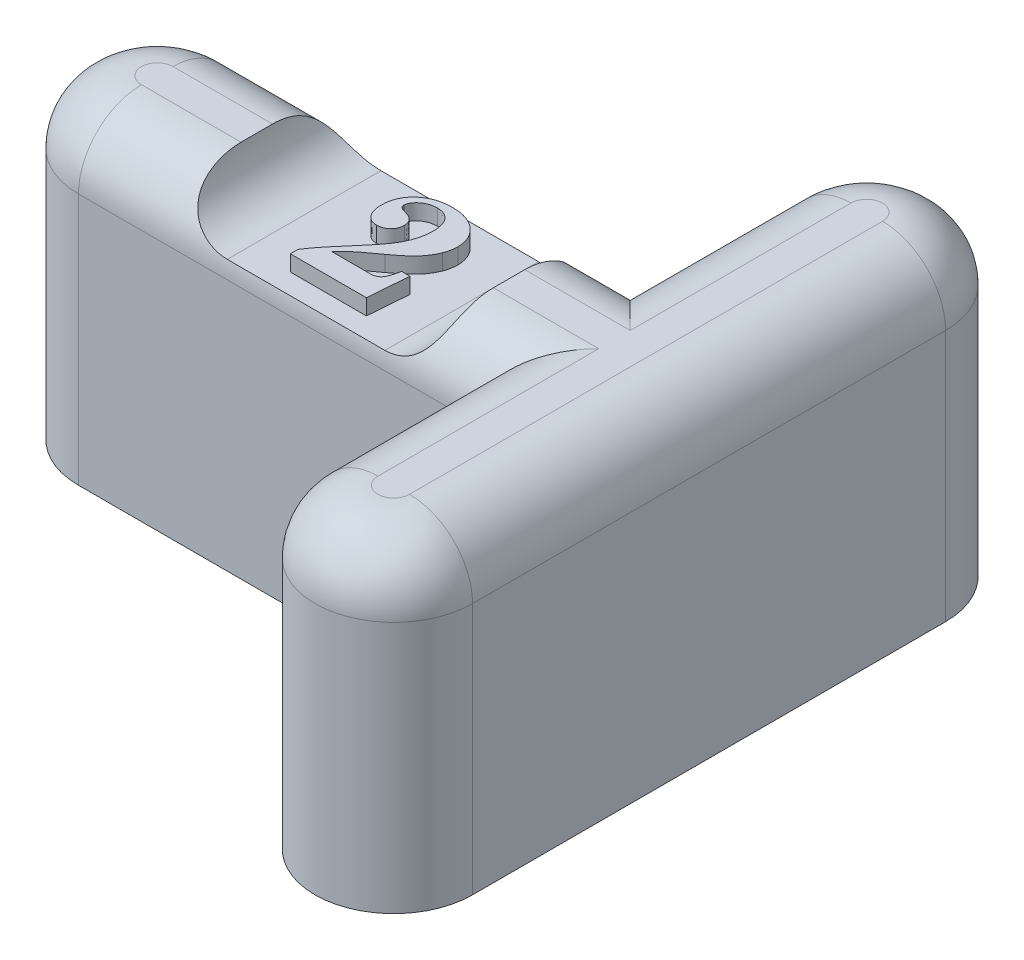
from build123d import *

# Parameters (mm, degrees)
BOSS_EXTRUDE1_DEPTH     = 20
FILLET1_R               = 4
SKETCH2_R               = 2.75
CUT_EXTRUDE1_DEPTH      = 1.5
LPATTERN1_COUNT         = 2
LPATTERN1_PITCH         = 30
CUT_EXTRUDE2_DEPTH      = 35.641016151
CUT_EXTRUDE2_DEPTH_BACK = 35.641016151
WRAP1_DEPTH             = 1


# Read off the part's stored shape, not the designer's step: Wrap1
with BuildPart() as part:
    # Sketch1 → Boss-Extrude1 (new body)
    with BuildSketch(Plane(origin=(0, 0, 0), x_dir=(1, 0, 0), z_dir=(0, 1, 0))):
        with BuildLine():
            Line((-15, -5), (10, -5))
            Line((10, -5), (10, -15))
            ThreePointArc((10, -15), (15, -20), (20, -15))
            Line((20, -15), (20, 15))
            ThreePointArc((20, 15), (15, 20), (10, 15))
            Line((10, 15), (10, 5))
            Line((10, 5), (-15, 5))
            ThreePointArc((-15, 5), (-20, 0), (-15, -5))
        make_face()
    extrude(amount=BOSS_EXTRUDE1_DEPTH)

    # Fillet1
    fillet1_edges = [part.edges().sort_by_distance(p)[0] for p in [
        (15, 20, 20),
        (20, 20, 0),
        (15, 20, -20),
        (10, 20, -10),
        (-2.5, 20, -5),
        (-20, 20, 0),
        (-2.5, 20, 5),
        (10, 20, 10),
    ]]
    fillet(fillet1_edges, radius=FILLET1_R)

    # Sketch2 → Cut-Extrude1 (cut)
    with BuildSketch(Plane.XZ):
        with Locations(Location((-15, 0, 0), (0, 0, 270))):
            Circle(SKETCH2_R)
    cut_extrude1 = extrude(amount=-CUT_EXTRUDE1_DEPTH, mode=Mode.SUBTRACT)

    # LPattern1: Cut-Extrude1 ×2
    with Locations(*[(i * LPATTERN1_PITCH, 0, 0) for i in range(1, LPATTERN1_COUNT)]):
        add(cut_extrude1, mode=Mode.SUBTRACT)

    # Sketch3 → Cut-Extrude2 (cut, two sides: drawn at the far end of the back side and taken through both)
    with BuildSketch(Plane.XY.offset(-CUT_EXTRUDE2_DEPTH_BACK)):
        with BuildLine():
            Line((4.311759309, 17), (-5.688240691, 17))
            ThreePointArc((-5.688240691, 17), (-8.688240691, 20), (-5.688240691, 23))
            Line((-5.688240691, 23), (4.311759309, 23))
            ThreePointArc((4.311759309, 23), (7.311759309, 20), (4.311759309, 17))
        make_face()
    extrude(amount=CUT_EXTRUDE2_DEPTH + CUT_EXTRUDE2_DEPTH_BACK, mode=Mode.SUBTRACT)

    # Wrap1 outline → Wrap1 (add)
    with BuildSketch(Plane(origin=(0, 17, 0), x_dir=(1, 0, 0), z_dir=(0, 1, 0))):
        with BuildLine():
            add(Edge.make_bspline(
                [(0.642286392, -2.130929983), (0.697068251, -2.128907224), (0.801863654, -2.125037772), (0.949149402, -2.083592189), (1.077845848, -2.017679587), (1.167841133, -1.937322521), (1.228987071, -1.856304156), (1.273909876, -1.779905728), (1.316783825, -1.687993871), (1.357834668, -1.580688743), (1.397843446, -1.45819824), (1.43651507, -1.32040959), (1.470556147, -1.166470279), (1.492845203, -1.058839499), (1.504465879, -1.002724855)],
                knots=[0, 0, 0, 0, 0.10403341, 0.199011557, 0.288612319, 0.377191825, 0.425797175, 0.481425289, 0.545557079, 0.61863331, 0.699984683, 0.790771883, 0.890916323, 1, 1, 1, 1], degree=3))
            Line((0.642286392, -2.130929983), (-1.828867454, -2.130929983))
            add(Edge.make_bspline(
                [(0.033312033, -0.597276137), (-0.0386828, -0.649792202), (-0.177152219, -0.750797632), (-0.378312337, -0.893483351), (-0.55842377, -1.029096706), (-0.723257087, -1.150840306), (-0.869351346, -1.262329216), (-0.998302375, -1.361959094), (-1.10903642, -1.449941477), (-1.28814467, -1.598324583), (-1.533492369, -1.817053984), (-1.730967833, -2.026898387), (-1.828867454, -2.130929983)],
                knots=[0, 0, 0, 0, 0.110593572, 0.212707314, 0.306051588, 0.390379305, 0.467018215, 0.534117187, 0.592614819, 0.642525788, 0.822780058, 1, 1, 1, 1], degree=3))
            add(Edge.make_bspline(
                [(1.776901777, 1.311377709), (1.740508951, 1.227820861), (1.668557348, 1.062622117), (1.534204098, 0.829135836), (1.386697948, 0.607494657), (1.244802071, 0.434383848), (1.118782123, 0.297042886), (1.007796173, 0.188820856), (0.882685975, 0.07346838), (0.742894284, -0.048629756), (0.587320619, -0.176805638), (0.415288522, -0.310610766), (0.2304995, -0.453672521), (0.100336358, -0.548465046), (0.033312033, -0.597276137)],
                knots=[0, 0, 0, 0, 0.10413489, 0.205883221, 0.307528832, 0.408265615, 0.461433854, 0.520606469, 0.585444086, 0.656004792, 0.732803839, 0.815893726, 0.905198979, 1, 1, 1, 1], degree=3))
            add(Edge.make_bspline(
                [(1.932350495, 2.136698222), (1.930582762, 2.062880935), (1.927122795, 1.918399078), (1.89755374, 1.706264085), (1.84849522, 1.503780463), (1.800603462, 1.375074458), (1.776901777, 1.311377709)],
                knots=[0, 0, 0, 0, 0.261979501, 0.512769921, 0.758869279, 1, 1, 1, 1], degree=3))
            add(Edge.make_bspline(
                [(-0.388162326, 4.125480273), (-0.303707583, 4.12339455), (-0.138146382, 4.119305794), (0.104348239, 4.094322221), (0.334199152, 4.049032745), (0.552032966, 3.987362832), (0.755746261, 3.904474972), (0.948486885, 3.807269943), (1.127008185, 3.688779019), (1.29265723, 3.555020212), (1.442651526, 3.408718608), (1.573777626, 3.252009266), (1.685027299, 3.086825419), (1.774984999, 2.912292074), (1.84656933, 2.730494708), (1.895481593, 2.539900922), (1.927600541, 2.341314519), (1.930747814, 2.205737762), (1.932350495, 2.136698222)],
                knots=[0, 0, 0, 0, 0.074102612, 0.14526736, 0.21355926, 0.279416432, 0.343556942, 0.406228654, 0.468492489, 0.531146675, 0.592790073, 0.652016559, 0.710119813, 0.767135501, 0.823967905, 0.881147087, 0.939476717, 1, 1, 1, 1], degree=3))
            add(Edge.make_bspline(
                [(-2.232713608, 3.426762325), (-2.174578401, 3.482587233), (-2.058827061, 3.593738602), (-1.864882005, 3.736329065), (-1.656738454, 3.857947931), (-1.432063466, 3.955468271), (-1.192752558, 4.032638511), (-0.937718651, 4.086841711), (-0.667834214, 4.118962783), (-0.482802481, 4.123274773), (-0.388162326, 4.125480273)],
                knots=[0, 0, 0, 0, 0.119107626, 0.23715177, 0.355050392, 0.47498588, 0.598670295, 0.726365388, 0.860041186, 1, 1, 1, 1], degree=3))
            add(Edge.make_bspline(
                [(-2.785598223, 2.013300786), (-2.784394541, 2.082312013), (-2.782023884, 2.218229886), (-2.753321432, 2.417122778), (-2.710103784, 2.60744864), (-2.651357085, 2.790152567), (-2.572072004, 2.963056206), (-2.476765909, 3.127882021), (-2.364969308, 3.284525799), (-2.277066734, 3.37906204), (-2.232713608, 3.426762325)],
                knots=[0, 0, 0, 0, 0.132803649, 0.26155729, 0.386082589, 0.508400008, 0.630401232, 0.751619273, 0.874674186, 1, 1, 1, 1], degree=3))
            add(Edge.make_bspline(
                [(-1.846495659, 0.740864889), (-1.911692811, 0.744593035), (-2.039415236, 0.751896541), (-2.221354354, 0.81840918), (-2.384963788, 0.925389692), (-2.52811329, 1.073519138), (-2.646394125, 1.259179854), (-2.725831466, 1.482698646), (-2.778884617, 1.736778724), (-2.78328218, 1.917906901), (-2.785598223, 2.013300786)],
                knots=[0, 0, 0, 0, 0.110139331, 0.215764983, 0.323707128, 0.438906263, 0.562183724, 0.693638164, 0.838649921, 1, 1, 1, 1], degree=3))
            add(Edge.make_bspline(
                [(-0.939444377, 1.612659761), (-0.942326557, 1.551960945), (-0.947934369, 1.433860184), (-0.997595897, 1.264649486), (-1.080902013, 1.112839431), (-1.19549024, 0.981777057), (-1.332754382, 0.874855041), (-1.488847868, 0.794903834), (-1.662991519, 0.750426786), (-1.78428981, 0.744106265), (-1.846495659, 0.740864889)],
                knots=[0, 0, 0, 0, 0.129242333, 0.251464839, 0.372304265, 0.495878621, 0.620081591, 0.741344555, 0.867352775, 1, 1, 1, 1], degree=3))
            add(Edge.make_bspline(
                [(-1.599700787, 2.353044376), (-1.547384069, 2.337905668), (-1.447953444, 2.309133772), (-1.312587971, 2.245529061), (-1.198390963, 2.170222425), (-1.101837624, 2.084505309), (-1.029035869, 1.983439418), (-0.977250141, 1.870166251), (-0.943647162, 1.745449607), (-0.940871626, 1.657754643), (-0.939444377, 1.612659761)],
                knots=[0, 0, 0, 0, 0.151156851, 0.287281401, 0.413669873, 0.530293514, 0.644009236, 0.756908248, 0.874996313, 1, 1, 1, 1], degree=3))
            add(Edge.make_bspline(
                [(-1.985918736, 2.508493094), (-1.968181193, 2.494954643), (-1.926034288, 2.462785373), (-1.840071641, 2.427927315), (-1.730183537, 2.386766122), (-1.645939164, 2.364994146), (-1.599700787, 2.353044376)],
                knots=[0, 0, 0, 0, 0.159109439, 0.378066483, 0.65864549, 1, 1, 1, 1], degree=3))
            add(Edge.make_bspline(
                [(-2.067649505, 2.707211043), (-2.06697518, 2.68730288), (-2.065674476, 2.648902137), (-2.048618651, 2.595076486), (-2.023115468, 2.546969231), (-1.998340109, 2.521341708), (-1.985918736, 2.508493094)],
                knots=[0, 0, 0, 0, 0.268945253, 0.518766978, 0.758729042, 1, 1, 1, 1], degree=3))
            add(Edge.make_bspline(
                [(-0.835277711, 3.612659761), (-0.919974504, 3.608952512), (-1.083758031, 3.601783572), (-1.318782591, 3.546873622), (-1.531192675, 3.452372344), (-1.715242967, 3.323572195), (-1.866779882, 3.177417165), (-1.981665445, 3.025896999), (-2.053298023, 2.867982131), (-2.062967336, 2.759662589), (-2.067649505, 2.707211043)],
                knots=[0, 0, 0, 0, 0.151816317, 0.293576777, 0.429964406, 0.566304914, 0.694365033, 0.806085808, 0.906100976, 1, 1, 1, 1], degree=3))
            add(Edge.make_bspline(
                [(0.291324854, 2.20240335), (0.290526102, 2.258536747), (0.288979016, 2.367260322), (0.273591459, 2.524471502), (0.252731859, 2.671716827), (0.217786162, 2.807822742), (0.1778813, 2.935483939), (0.123500501, 3.050983853), (0.063626983, 3.157905367), (-0.008178329, 3.252561617), (-0.085758475, 3.338410694), (-0.173891916, 3.410346686), (-0.266765487, 3.473437461), (-0.366515873, 3.525467854), (-0.474178976, 3.563375678), (-0.587640915, 3.593014341), (-0.709335642, 3.608329302), (-0.792507433, 3.611189125), (-0.835277711, 3.612659761)],
                knots=[0, 0, 0, 0, 0.082284271, 0.159374645, 0.231497254, 0.300083139, 0.36523236, 0.427274673, 0.486932074, 0.544586116, 0.60112786, 0.656190593, 0.710940404, 0.765594865, 0.820607428, 0.877984079, 0.93725451, 1, 1, 1, 1], degree=3))
            add(Edge.make_bspline(
                [(-0.120534121, 0.617467453), (-0.087631398, 0.682242904), (-0.022410558, 0.810642898), (0.059592915, 1.00837199), (0.133391689, 1.205389814), (0.190307433, 1.404442147), (0.23563293, 1.603431449), (0.267551697, 1.802554334), (0.287665936, 2.002200968), (0.290103637, 2.135582901), (0.291324854, 2.20240335)],
                knots=[0, 0, 0, 0, 0.131745637, 0.261150462, 0.388067803, 0.513189353, 0.636374668, 0.758087597, 0.878808958, 1, 1, 1, 1], degree=3))
            add(Edge.make_bspline(
                [(-1.442649505, -1.126122291), (-1.361234552, -1.032293131), (-1.204288289, -0.851415596), (-0.981898657, -0.588061945), (-0.782407297, -0.342434467), (-0.606431363, -0.115092397), (-0.451519673, 0.093133402), (-0.320499332, 0.283695978), (-0.209591503, 0.454792752), (-0.148797168, 0.565841382), (-0.120534121, 0.617467453)],
                knots=[0, 0, 0, 0, 0.170005554, 0.327725258, 0.471696803, 0.603008639, 0.721148947, 0.826797124, 0.919478664, 1, 1, 1, 1], degree=3))
            add(Edge.make_bspline(
                [(-2.990726428, -3.076442803), (-2.954971201, -3.01943664), (-2.877860792, -2.896496053), (-2.741064902, -2.707351079), (-2.585586618, -2.49324133), (-2.400823944, -2.262132153), (-2.196591131, -2.006696342), (-1.966865337, -1.731453905), (-1.71374383, -1.434874025), (-1.535322142, -1.23166798), (-1.442649505, -1.126122291)],
                knots=[0, 0, 0, 0, 0.080973991, 0.174630064, 0.280853316, 0.39944862, 0.530692677, 0.674513651, 0.830941638, 1, 1, 1, 1], degree=3))
            Line((-2.990726428, -3.076442803), (-2.990726428, -3.566827419))
            Line((-2.990726428, -3.566827419), (1.829786392, -3.566827419))
            Line((1.829786392, -3.566827419), (2.034914597, -1.002724855))
            Line((2.034914597, -1.002724855), (1.504465879, -1.002724855))
        make_face()
    extrude(amount=WRAP1_DEPTH)


solid = part.part
